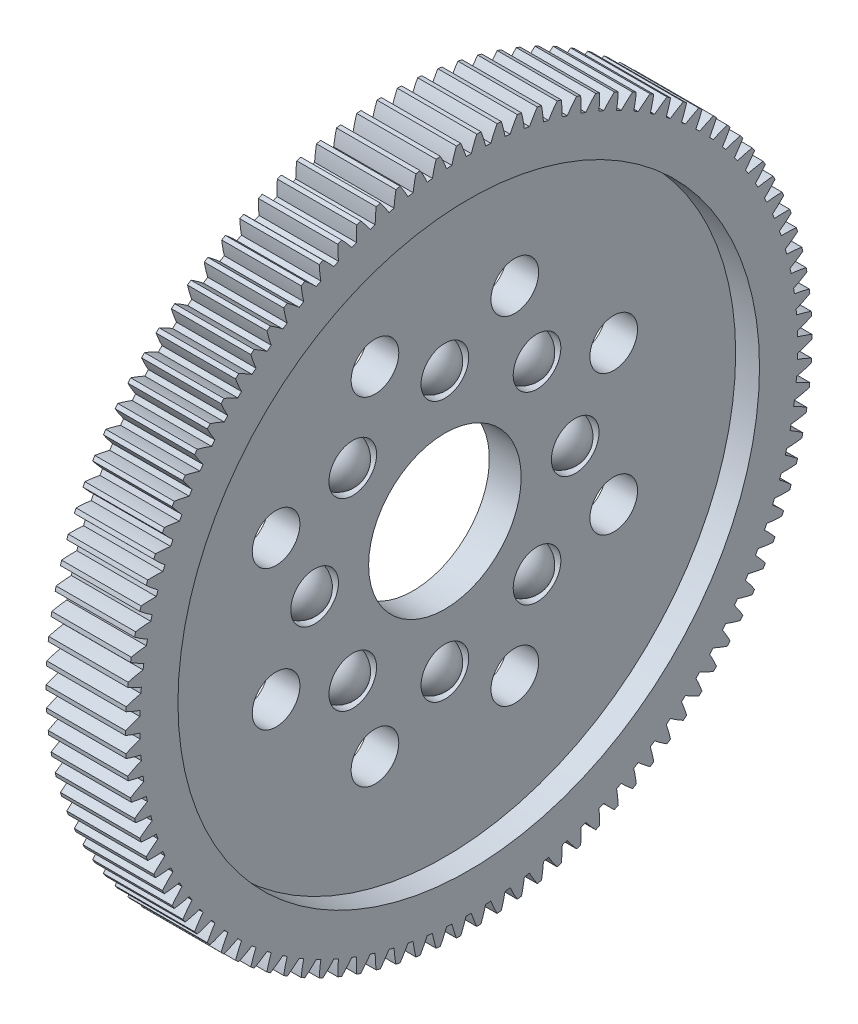
from build123d import *

# Parameters (mm, degrees)
BASPROSKE_W                    = 5
BASPROSKE_H                    = 21.6
TOOTHCUT_DEPTH                 = 31.953513532
TEETHCUTS_COUNT                = 106
BORSKE_R                       = 4.8
BORE_DEPTH                     = 50.0000508
SKETCH2_R                      = 18.3
CUT_EXTRUDE1_DEPTH             = 1.5
CUT_EXTRUDE2_REACH             = 32.645
SKETCH3_R                      = 1.5
CUT_EXTRUDE2_DIRECTION_2_REACH = 32.645
CIRPATTERN3_COUNT              = 8


with BuildPart() as part:
    # BasProSke → Base-Revolve (revolve)
    with BuildSketch(Plane(origin=(0, 0, 0), x_dir=(1, 0, 0), z_dir=(0, 1, 0))):
        with Locations((2.5, 10.8)):
            Rectangle(BASPROSKE_W, BASPROSKE_H)
    revolve(axis=Axis((-10, 0, 0), (1, 0, 0)))

    # TooCutSke → ToothCut (cut, through all)
    with BuildSketch(Plane(origin=(0, 0, 0), x_dir=(0, 0, -1), z_dir=(1, 0, 0))):
        with BuildLine():
            ThreePointArc((0.164803514, 20.698343914), (0, 20.699), (-0.164803514, 20.698343914))
            ThreePointArc((-0.164803514, 20.698343914), (-0.327553518, 21.163904781), (-0.517093365, 21.619216906))
            ThreePointArc((-0.517093365, 21.619216906), (0, 21.6254), (0.517093365, 21.619216906))
            ThreePointArc((0.517093365, 21.619216906), (0.327553518, 21.163904781), (0.164803514, 20.698343914))
        make_face()
    toothcut = extrude(amount=TOOTHCUT_DEPTH, mode=Mode.SUBTRACT)

    # TeethCuts: ToothCut ×106 about axis
    teethcuts_axis = Axis((-10, 0, 0), (1, 0, 0))
    for i in range(1, TEETHCUTS_COUNT):
        add(toothcut.rotate(teethcuts_axis, i * 360 / TEETHCUTS_COUNT), mode=Mode.SUBTRACT)

    # BorSke → Bore (cut, symmetric)
    with BuildSketch(Plane(origin=(0, 0, 0), x_dir=(0, 0, -1), z_dir=(1, 0, 0))):
        Circle(BORSKE_R)
    extrude(amount=BORE_DEPTH, both=True, mode=Mode.SUBTRACT)

    # Sketch2 → Cut-Extrude1 (cut)
    with BuildSketch(Plane(origin=(5, 0, 0), x_dir=(0, 0, -1), z_dir=(1, 0, 0))):
        Circle(SKETCH2_R)
    cut_extrude1 = extrude(amount=-CUT_EXTRUDE1_DEPTH, mode=Mode.SUBTRACT)

    # Mirror1: Cut-Extrude1 across plane
    add(cut_extrude1.mirror(Plane(origin=(2.5, 0, 0), x_dir=(0, 0, 1), z_dir=(1, 0, 0))), mode=Mode.SUBTRACT)

    # Sketch3 → Cut-Extrude2 (cut, up to next)
    with BuildSketch(Plane(origin=(2.5, 0, 0), x_dir=(0, 0, -1), z_dir=(1, 0, 0)), mode=Mode.PRIVATE) as cut_extrude2_sk1:
        with Locations((0, 8.2)):
            Circle(SKETCH3_R)
    cut_extrude2_tool1 = extrude(cut_extrude2_sk1.sketch, amount=-CUT_EXTRUDE2_REACH, mode=Mode.PRIVATE) & part.part
    # Sketch3 → Cut-Extrude2 (cut, up to next)
    with BuildSketch(Plane(origin=(2.5, 0, 0), x_dir=(0, 0, -1), z_dir=(1, 0, 0)), mode=Mode.PRIVATE) as cut_extrude2_sk2:
        with Locations((5.798275606, 5.798275606)):
            Circle(SKETCH3_R)
    cut_extrude2_tool2 = extrude(cut_extrude2_sk2.sketch, amount=-CUT_EXTRUDE2_REACH, mode=Mode.PRIVATE) & part.part
    # Sketch3 → Cut-Extrude2 (cut, up to next)
    with BuildSketch(Plane(origin=(2.5, 0, 0), x_dir=(0, 0, -1), z_dir=(1, 0, 0)), mode=Mode.PRIVATE) as cut_extrude2_sk3:
        with Locations((8.2, 0)):
            Circle(SKETCH3_R)
    cut_extrude2_tool3 = extrude(cut_extrude2_sk3.sketch, amount=-CUT_EXTRUDE2_REACH, mode=Mode.PRIVATE) & part.part
    # Sketch3 → Cut-Extrude2 (cut, up to next)
    with BuildSketch(Plane(origin=(2.5, 0, 0), x_dir=(0, 0, -1), z_dir=(1, 0, 0)), mode=Mode.PRIVATE) as cut_extrude2_sk4:
        with Locations((5.798275606, -5.798275606)):
            Circle(SKETCH3_R)
    cut_extrude2_tool4 = extrude(cut_extrude2_sk4.sketch, amount=-CUT_EXTRUDE2_REACH, mode=Mode.PRIVATE) & part.part
    # Sketch3 → Cut-Extrude2 (cut, up to next)
    with BuildSketch(Plane(origin=(2.5, 0, 0), x_dir=(0, 0, -1), z_dir=(1, 0, 0)), mode=Mode.PRIVATE) as cut_extrude2_sk5:
        with Locations((0, -8.2)):
            Circle(SKETCH3_R)
    cut_extrude2_tool5 = extrude(cut_extrude2_sk5.sketch, amount=-CUT_EXTRUDE2_REACH, mode=Mode.PRIVATE) & part.part
    # Sketch3 → Cut-Extrude2 (cut, up to next)
    with BuildSketch(Plane(origin=(2.5, 0, 0), x_dir=(0, 0, -1), z_dir=(1, 0, 0)), mode=Mode.PRIVATE) as cut_extrude2_sk6:
        with Locations((-5.798275606, -5.798275606)):
            Circle(SKETCH3_R)
    cut_extrude2_tool6 = extrude(cut_extrude2_sk6.sketch, amount=-CUT_EXTRUDE2_REACH, mode=Mode.PRIVATE) & part.part
    # Sketch3 → Cut-Extrude2 (cut, up to next)
    with BuildSketch(Plane(origin=(2.5, 0, 0), x_dir=(0, 0, -1), z_dir=(1, 0, 0)), mode=Mode.PRIVATE) as cut_extrude2_sk7:
        with Locations((-8.2, 0)):
            Circle(SKETCH3_R)
    cut_extrude2_tool7 = extrude(cut_extrude2_sk7.sketch, amount=-CUT_EXTRUDE2_REACH, mode=Mode.PRIVATE) & part.part
    # Sketch3 → Cut-Extrude2 (cut, up to next)
    with BuildSketch(Plane(origin=(2.5, 0, 0), x_dir=(0, 0, -1), z_dir=(1, 0, 0)), mode=Mode.PRIVATE) as cut_extrude2_sk8:
        with Locations((-5.798275606, 5.798275606)):
            Circle(SKETCH3_R)
    cut_extrude2_tool8 = extrude(cut_extrude2_sk8.sketch, amount=-CUT_EXTRUDE2_REACH, mode=Mode.PRIVATE) & part.part
    # Sketch3 → Cut-Extrude2 (cut, up to next)
    with BuildSketch(Plane(origin=(2.5, 0, 0), x_dir=(0, 0, -1), z_dir=(1, 0, 0)), mode=Mode.PRIVATE) as cut_extrude2_sk9:
        with Locations((-4.400859472, 10.624614624)):
            Circle(SKETCH3_R)
    cut_extrude2_tool9 = extrude(cut_extrude2_sk9.sketch, amount=-CUT_EXTRUDE2_REACH, mode=Mode.PRIVATE) & part.part
    # Sketch3 → Cut-Extrude2 (cut, up to next)
    with BuildSketch(Plane(origin=(2.5, 0, 0), x_dir=(0, 0, -1), z_dir=(1, 0, 0)), mode=Mode.PRIVATE) as cut_extrude2_sk10:
        with Locations((4.400859472, 10.624614624)):
            Circle(SKETCH3_R)
    cut_extrude2_tool10 = extrude(cut_extrude2_sk10.sketch, amount=-CUT_EXTRUDE2_REACH, mode=Mode.PRIVATE) & part.part
    # Sketch3 → Cut-Extrude2 (cut, up to next)
    with BuildSketch(Plane(origin=(2.5, 0, 0), x_dir=(0, 0, -1), z_dir=(1, 0, 0)), mode=Mode.PRIVATE) as cut_extrude2_sk11:
        with Locations((10.624614624, 4.400859472)):
            Circle(SKETCH3_R)
    cut_extrude2_tool11 = extrude(cut_extrude2_sk11.sketch, amount=-CUT_EXTRUDE2_REACH, mode=Mode.PRIVATE) & part.part
    # Sketch3 → Cut-Extrude2 (cut, up to next)
    with BuildSketch(Plane(origin=(2.5, 0, 0), x_dir=(0, 0, -1), z_dir=(1, 0, 0)), mode=Mode.PRIVATE) as cut_extrude2_sk12:
        with Locations((10.624614624, -4.400859472)):
            Circle(SKETCH3_R)
    cut_extrude2_tool12 = extrude(cut_extrude2_sk12.sketch, amount=-CUT_EXTRUDE2_REACH, mode=Mode.PRIVATE) & part.part
    # Sketch3 → Cut-Extrude2 (cut, up to next)
    with BuildSketch(Plane(origin=(2.5, 0, 0), x_dir=(0, 0, -1), z_dir=(1, 0, 0)), mode=Mode.PRIVATE) as cut_extrude2_sk13:
        with Locations((4.400859472, -10.624614624)):
            Circle(SKETCH3_R)
    cut_extrude2_tool13 = extrude(cut_extrude2_sk13.sketch, amount=-CUT_EXTRUDE2_REACH, mode=Mode.PRIVATE) & part.part
    # Sketch3 → Cut-Extrude2 (cut, up to next)
    with BuildSketch(Plane(origin=(2.5, 0, 0), x_dir=(0, 0, -1), z_dir=(1, 0, 0)), mode=Mode.PRIVATE) as cut_extrude2_sk14:
        with Locations((-4.400859472, -10.624614624)):
            Circle(SKETCH3_R)
    cut_extrude2_tool14 = extrude(cut_extrude2_sk14.sketch, amount=-CUT_EXTRUDE2_REACH, mode=Mode.PRIVATE) & part.part
    # Sketch3 → Cut-Extrude2 (cut, up to next)
    with BuildSketch(Plane(origin=(2.5, 0, 0), x_dir=(0, 0, -1), z_dir=(1, 0, 0)), mode=Mode.PRIVATE) as cut_extrude2_sk15:
        with Locations((-10.624614624, -4.400859472)):
            Circle(SKETCH3_R)
    cut_extrude2_tool15 = extrude(cut_extrude2_sk15.sketch, amount=-CUT_EXTRUDE2_REACH, mode=Mode.PRIVATE) & part.part
    # Sketch3 → Cut-Extrude2 (cut, up to next)
    with BuildSketch(Plane(origin=(2.5, 0, 0), x_dir=(0, 0, -1), z_dir=(1, 0, 0)), mode=Mode.PRIVATE) as cut_extrude2_sk16:
        with Locations((-10.624614624, 4.400859472)):
            Circle(SKETCH3_R)
    cut_extrude2_tool16 = extrude(cut_extrude2_sk16.sketch, amount=-CUT_EXTRUDE2_REACH, mode=Mode.PRIVATE) & part.part
    add(cut_extrude2_tool1.solids().sort_by_distance((2.5, 8.2, 0))[0], mode=Mode.SUBTRACT)
    add(cut_extrude2_tool2.solids().sort_by_distance((2.5, 5.798276, -5.798276))[0], mode=Mode.SUBTRACT)
    add(cut_extrude2_tool3.solids().sort_by_distance((2.5, 0, -8.2))[0], mode=Mode.SUBTRACT)
    add(cut_extrude2_tool4.solids().sort_by_distance((2.5, -5.798276, -5.798276))[0], mode=Mode.SUBTRACT)
    add(cut_extrude2_tool5.solids().sort_by_distance((2.5, -8.2, 0))[0], mode=Mode.SUBTRACT)
    add(cut_extrude2_tool6.solids().sort_by_distance((2.5, -5.798276, 5.798276))[0], mode=Mode.SUBTRACT)
    add(cut_extrude2_tool7.solids().sort_by_distance((2.5, 0, 8.2))[0], mode=Mode.SUBTRACT)
    add(cut_extrude2_tool8.solids().sort_by_distance((2.5, 5.798276, 5.798276))[0], mode=Mode.SUBTRACT)
    add(cut_extrude2_tool9.solids().sort_by_distance((2.5, 10.624615, 4.400859))[0], mode=Mode.SUBTRACT)
    add(cut_extrude2_tool10.solids().sort_by_distance((2.5, 10.624615, -4.400859))[0], mode=Mode.SUBTRACT)
    add(cut_extrude2_tool11.solids().sort_by_distance((2.5, 4.400859, -10.624615))[0], mode=Mode.SUBTRACT)
    add(cut_extrude2_tool12.solids().sort_by_distance((2.5, -4.400859, -10.624615))[0], mode=Mode.SUBTRACT)
    add(cut_extrude2_tool13.solids().sort_by_distance((2.5, -10.624615, -4.400859))[0], mode=Mode.SUBTRACT)
    add(cut_extrude2_tool14.solids().sort_by_distance((2.5, -10.624615, 4.400859))[0], mode=Mode.SUBTRACT)
    add(cut_extrude2_tool15.solids().sort_by_distance((2.5, -4.400859, 10.624615))[0], mode=Mode.SUBTRACT)
    add(cut_extrude2_tool16.solids().sort_by_distance((2.5, 4.400859, 10.624615))[0], mode=Mode.SUBTRACT)

    # Sketch3 → Cut-Extrude2 direction 2 (cut, up to next)
    with BuildSketch(Plane(origin=(2.5, 0, 0), x_dir=(0, 0, -1), z_dir=(1, 0, 0)), mode=Mode.PRIVATE) as cut_extrude2_direction_2_sk1:
        with Locations((0, 8.2)):
            Circle(SKETCH3_R)
    cut_extrude2_direction_2_tool1 = extrude(cut_extrude2_direction_2_sk1.sketch, amount=CUT_EXTRUDE2_DIRECTION_2_REACH, mode=Mode.PRIVATE) & part.part
    # Sketch3 → Cut-Extrude2 direction 2 (cut, up to next)
    with BuildSketch(Plane(origin=(2.5, 0, 0), x_dir=(0, 0, -1), z_dir=(1, 0, 0)), mode=Mode.PRIVATE) as cut_extrude2_direction_2_sk2:
        with Locations((5.798275606, 5.798275606)):
            Circle(SKETCH3_R)
    cut_extrude2_direction_2_tool2 = extrude(cut_extrude2_direction_2_sk2.sketch, amount=CUT_EXTRUDE2_DIRECTION_2_REACH, mode=Mode.PRIVATE) & part.part
    # Sketch3 → Cut-Extrude2 direction 2 (cut, up to next)
    with BuildSketch(Plane(origin=(2.5, 0, 0), x_dir=(0, 0, -1), z_dir=(1, 0, 0)), mode=Mode.PRIVATE) as cut_extrude2_direction_2_sk3:
        with Locations((8.2, 0)):
            Circle(SKETCH3_R)
    cut_extrude2_direction_2_tool3 = extrude(cut_extrude2_direction_2_sk3.sketch, amount=CUT_EXTRUDE2_DIRECTION_2_REACH, mode=Mode.PRIVATE) & part.part
    # Sketch3 → Cut-Extrude2 direction 2 (cut, up to next)
    with BuildSketch(Plane(origin=(2.5, 0, 0), x_dir=(0, 0, -1), z_dir=(1, 0, 0)), mode=Mode.PRIVATE) as cut_extrude2_direction_2_sk4:
        with Locations((5.798275606, -5.798275606)):
            Circle(SKETCH3_R)
    cut_extrude2_direction_2_tool4 = extrude(cut_extrude2_direction_2_sk4.sketch, amount=CUT_EXTRUDE2_DIRECTION_2_REACH, mode=Mode.PRIVATE) & part.part
    # Sketch3 → Cut-Extrude2 direction 2 (cut, up to next)
    with BuildSketch(Plane(origin=(2.5, 0, 0), x_dir=(0, 0, -1), z_dir=(1, 0, 0)), mode=Mode.PRIVATE) as cut_extrude2_direction_2_sk5:
        with Locations((0, -8.2)):
            Circle(SKETCH3_R)
    cut_extrude2_direction_2_tool5 = extrude(cut_extrude2_direction_2_sk5.sketch, amount=CUT_EXTRUDE2_DIRECTION_2_REACH, mode=Mode.PRIVATE) & part.part
    # Sketch3 → Cut-Extrude2 direction 2 (cut, up to next)
    with BuildSketch(Plane(origin=(2.5, 0, 0), x_dir=(0, 0, -1), z_dir=(1, 0, 0)), mode=Mode.PRIVATE) as cut_extrude2_direction_2_sk6:
        with Locations((-5.798275606, -5.798275606)):
            Circle(SKETCH3_R)
    cut_extrude2_direction_2_tool6 = extrude(cut_extrude2_direction_2_sk6.sketch, amount=CUT_EXTRUDE2_DIRECTION_2_REACH, mode=Mode.PRIVATE) & part.part
    # Sketch3 → Cut-Extrude2 direction 2 (cut, up to next)
    with BuildSketch(Plane(origin=(2.5, 0, 0), x_dir=(0, 0, -1), z_dir=(1, 0, 0)), mode=Mode.PRIVATE) as cut_extrude2_direction_2_sk7:
        with Locations((-8.2, 0)):
            Circle(SKETCH3_R)
    cut_extrude2_direction_2_tool7 = extrude(cut_extrude2_direction_2_sk7.sketch, amount=CUT_EXTRUDE2_DIRECTION_2_REACH, mode=Mode.PRIVATE) & part.part
    # Sketch3 → Cut-Extrude2 direction 2 (cut, up to next)
    with BuildSketch(Plane(origin=(2.5, 0, 0), x_dir=(0, 0, -1), z_dir=(1, 0, 0)), mode=Mode.PRIVATE) as cut_extrude2_direction_2_sk8:
        with Locations((-5.798275606, 5.798275606)):
            Circle(SKETCH3_R)
    cut_extrude2_direction_2_tool8 = extrude(cut_extrude2_direction_2_sk8.sketch, amount=CUT_EXTRUDE2_DIRECTION_2_REACH, mode=Mode.PRIVATE) & part.part
    # Sketch3 → Cut-Extrude2 direction 2 (cut, up to next)
    with BuildSketch(Plane(origin=(2.5, 0, 0), x_dir=(0, 0, -1), z_dir=(1, 0, 0)), mode=Mode.PRIVATE) as cut_extrude2_direction_2_sk9:
        with Locations((-4.400859472, 10.624614624)):
            Circle(SKETCH3_R)
    cut_extrude2_direction_2_tool9 = extrude(cut_extrude2_direction_2_sk9.sketch, amount=CUT_EXTRUDE2_DIRECTION_2_REACH, mode=Mode.PRIVATE) & part.part
    # Sketch3 → Cut-Extrude2 direction 2 (cut, up to next)
    with BuildSketch(Plane(origin=(2.5, 0, 0), x_dir=(0, 0, -1), z_dir=(1, 0, 0)), mode=Mode.PRIVATE) as cut_extrude2_direction_2_sk10:
        with Locations((4.400859472, 10.624614624)):
            Circle(SKETCH3_R)
    cut_extrude2_direction_2_tool10 = extrude(cut_extrude2_direction_2_sk10.sketch, amount=CUT_EXTRUDE2_DIRECTION_2_REACH, mode=Mode.PRIVATE) & part.part
    # Sketch3 → Cut-Extrude2 direction 2 (cut, up to next)
    with BuildSketch(Plane(origin=(2.5, 0, 0), x_dir=(0, 0, -1), z_dir=(1, 0, 0)), mode=Mode.PRIVATE) as cut_extrude2_direction_2_sk11:
        with Locations((10.624614624, 4.400859472)):
            Circle(SKETCH3_R)
    cut_extrude2_direction_2_tool11 = extrude(cut_extrude2_direction_2_sk11.sketch, amount=CUT_EXTRUDE2_DIRECTION_2_REACH, mode=Mode.PRIVATE) & part.part
    # Sketch3 → Cut-Extrude2 direction 2 (cut, up to next)
    with BuildSketch(Plane(origin=(2.5, 0, 0), x_dir=(0, 0, -1), z_dir=(1, 0, 0)), mode=Mode.PRIVATE) as cut_extrude2_direction_2_sk12:
        with Locations((10.624614624, -4.400859472)):
            Circle(SKETCH3_R)
    cut_extrude2_direction_2_tool12 = extrude(cut_extrude2_direction_2_sk12.sketch, amount=CUT_EXTRUDE2_DIRECTION_2_REACH, mode=Mode.PRIVATE) & part.part
    # Sketch3 → Cut-Extrude2 direction 2 (cut, up to next)
    with BuildSketch(Plane(origin=(2.5, 0, 0), x_dir=(0, 0, -1), z_dir=(1, 0, 0)), mode=Mode.PRIVATE) as cut_extrude2_direction_2_sk13:
        with Locations((4.400859472, -10.624614624)):
            Circle(SKETCH3_R)
    cut_extrude2_direction_2_tool13 = extrude(cut_extrude2_direction_2_sk13.sketch, amount=CUT_EXTRUDE2_DIRECTION_2_REACH, mode=Mode.PRIVATE) & part.part
    # Sketch3 → Cut-Extrude2 direction 2 (cut, up to next)
    with BuildSketch(Plane(origin=(2.5, 0, 0), x_dir=(0, 0, -1), z_dir=(1, 0, 0)), mode=Mode.PRIVATE) as cut_extrude2_direction_2_sk14:
        with Locations((-4.400859472, -10.624614624)):
            Circle(SKETCH3_R)
    cut_extrude2_direction_2_tool14 = extrude(cut_extrude2_direction_2_sk14.sketch, amount=CUT_EXTRUDE2_DIRECTION_2_REACH, mode=Mode.PRIVATE) & part.part
    # Sketch3 → Cut-Extrude2 direction 2 (cut, up to next)
    with BuildSketch(Plane(origin=(2.5, 0, 0), x_dir=(0, 0, -1), z_dir=(1, 0, 0)), mode=Mode.PRIVATE) as cut_extrude2_direction_2_sk15:
        with Locations((-10.624614624, -4.400859472)):
            Circle(SKETCH3_R)
    cut_extrude2_direction_2_tool15 = extrude(cut_extrude2_direction_2_sk15.sketch, amount=CUT_EXTRUDE2_DIRECTION_2_REACH, mode=Mode.PRIVATE) & part.part
    # Sketch3 → Cut-Extrude2 direction 2 (cut, up to next)
    with BuildSketch(Plane(origin=(2.5, 0, 0), x_dir=(0, 0, -1), z_dir=(1, 0, 0)), mode=Mode.PRIVATE) as cut_extrude2_direction_2_sk16:
        with Locations((-10.624614624, 4.400859472)):
            Circle(SKETCH3_R)
    cut_extrude2_direction_2_tool16 = extrude(cut_extrude2_direction_2_sk16.sketch, amount=CUT_EXTRUDE2_DIRECTION_2_REACH, mode=Mode.PRIVATE) & part.part
    add(cut_extrude2_direction_2_tool1.solids().sort_by_distance((2.5, 8.2, 0))[0], mode=Mode.SUBTRACT)
    add(cut_extrude2_direction_2_tool2.solids().sort_by_distance((2.5, 5.798276, -5.798276))[0], mode=Mode.SUBTRACT)
    add(cut_extrude2_direction_2_tool3.solids().sort_by_distance((2.5, 0, -8.2))[0], mode=Mode.SUBTRACT)
    add(cut_extrude2_direction_2_tool4.solids().sort_by_distance((2.5, -5.798276, -5.798276))[0], mode=Mode.SUBTRACT)
    add(cut_extrude2_direction_2_tool5.solids().sort_by_distance((2.5, -8.2, 0))[0], mode=Mode.SUBTRACT)
    add(cut_extrude2_direction_2_tool6.solids().sort_by_distance((2.5, -5.798276, 5.798276))[0], mode=Mode.SUBTRACT)
    add(cut_extrude2_direction_2_tool7.solids().sort_by_distance((2.5, 0, 8.2))[0], mode=Mode.SUBTRACT)
    add(cut_extrude2_direction_2_tool8.solids().sort_by_distance((2.5, 5.798276, 5.798276))[0], mode=Mode.SUBTRACT)
    add(cut_extrude2_direction_2_tool9.solids().sort_by_distance((2.5, 10.624615, 4.400859))[0], mode=Mode.SUBTRACT)
    add(cut_extrude2_direction_2_tool10.solids().sort_by_distance((2.5, 10.624615, -4.400859))[0], mode=Mode.SUBTRACT)
    add(cut_extrude2_direction_2_tool11.solids().sort_by_distance((2.5, 4.400859, -10.624615))[0], mode=Mode.SUBTRACT)
    add(cut_extrude2_direction_2_tool12.solids().sort_by_distance((2.5, -4.400859, -10.624615))[0], mode=Mode.SUBTRACT)
    add(cut_extrude2_direction_2_tool13.solids().sort_by_distance((2.5, -10.624615, -4.400859))[0], mode=Mode.SUBTRACT)
    add(cut_extrude2_direction_2_tool14.solids().sort_by_distance((2.5, -10.624615, 4.400859))[0], mode=Mode.SUBTRACT)
    add(cut_extrude2_direction_2_tool15.solids().sort_by_distance((2.5, -4.400859, 10.624615))[0], mode=Mode.SUBTRACT)
    add(cut_extrude2_direction_2_tool16.solids().sort_by_distance((2.5, 4.400859, 10.624615))[0], mode=Mode.SUBTRACT)

    # Sketch4 → Revolve1 (revolve)
    with BuildSketch(Plane(origin=(2.5, 0, 0), x_dir=(0, 0, -1), z_dir=(1, 0, 0))):
        with BuildLine():
            Line((0, 9.701), (0, 6.699))
            ThreePointArc((0, 6.699), (1.501, 8.2), (0, 9.701))
        make_face()
    revolve1 = revolve(axis=Axis((2.5, 9.701, 0), (0, -1, 0)))

    # CirPattern3: Revolve1 ×8 about axis
    cirpattern3_axis = Axis((-80.9, 0, 0), (1, 0, 0))
    for i in range(1, CIRPATTERN3_COUNT):
        add(revolve1.rotate(cirpattern3_axis, i * 360 / CIRPATTERN3_COUNT))


solid = part.part
